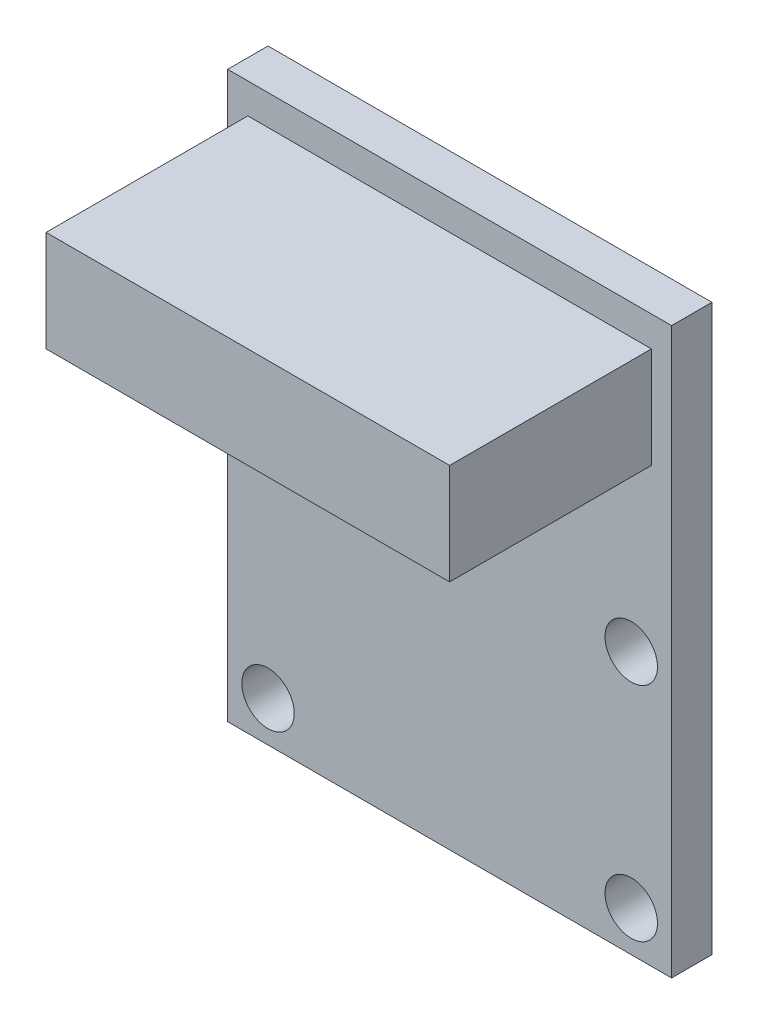
from build123d import *

# Parameters (mm, degrees)
SKETCH_1_W      = 22
SKETCH_1_H      = 28
SKETCH_1_R      = 1.3
EXTRUDE_1_DEPTH = 2
SKETCH_2_W      = 20
SKETCH_2_H      = 5
EXTRUDE_2_DEPTH = 10


with BuildPart() as part:
    # 草图1 → 凸台-拉伸1 (new body)
    with BuildSketch(Plane.XY):
        Rectangle(SKETCH_1_W, SKETCH_1_H)
        with Locations((-9, -11.997945994)):
            Circle(SKETCH_1_R, mode=Mode.SUBTRACT)
        with Locations((-9, -0.997945994)):
            Circle(SKETCH_1_R, mode=Mode.SUBTRACT)
        with Locations((9, -0.997945994)):
            Circle(SKETCH_1_R, mode=Mode.SUBTRACT)
        with Locations((9, -11.997945994)):
            Circle(SKETCH_1_R, mode=Mode.SUBTRACT)
    extrude(amount=EXTRUDE_1_DEPTH)

    # 草图2 → 凸台-拉伸2 (add)
    with BuildSketch(Plane.XY.offset(2)):
        with Locations((0, 10)):
            Rectangle(SKETCH_2_W, SKETCH_2_H)
    extrude(amount=EXTRUDE_2_DEPTH)


solid = part.part
